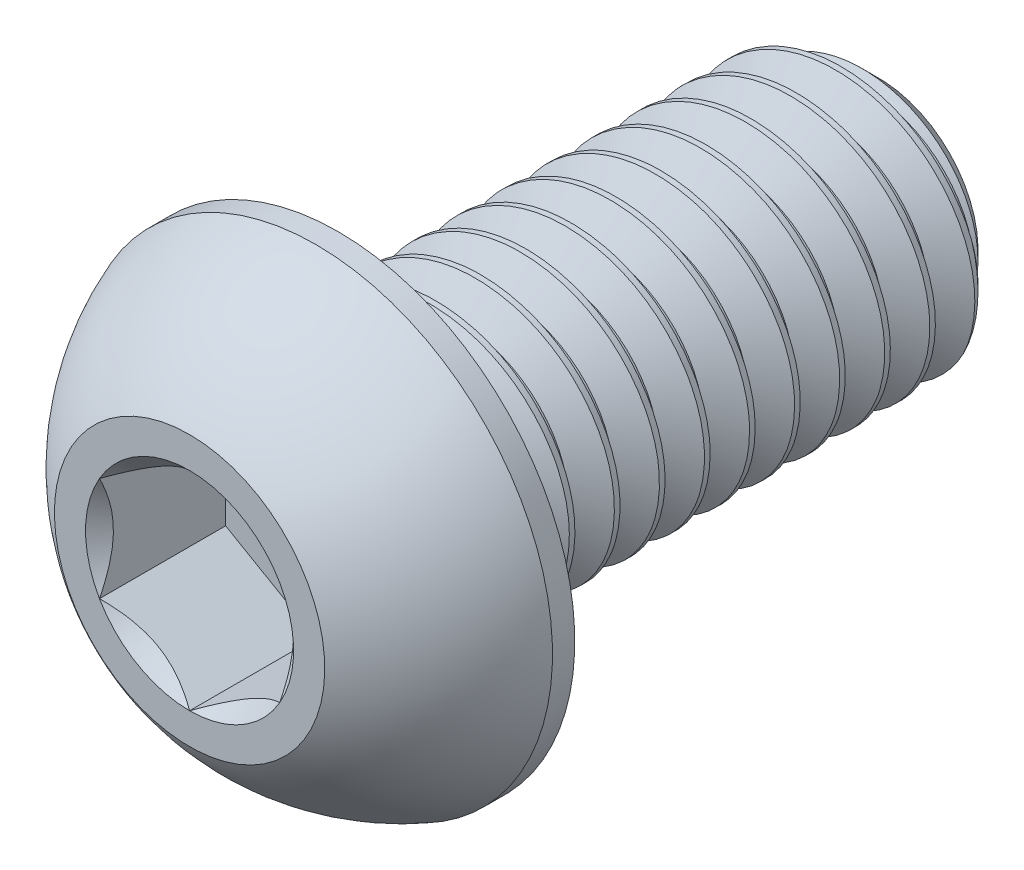
from build123d import *

# Parameters (mm, degrees)
CUT_EXTRUDE1_DEPTH = 2.8
CUT_SWEEP1_PITCH   = 1


# Read off the part's stored shape, not the designer's step: Split1, Boss-Extrude1
with BuildPart() as part:
    # Sketch2 → Revolve1 (revolve)
    with BuildSketch(Plane(origin=(0, 0, 0), x_dir=(0, 0, -1), z_dir=(1, 0, 0)), mode=Mode.PRIVATE) as revolve1_sk:
        with BuildLine():
            Line((-7.65, 0), (7.65, 0))
            Line((7.65, 0), (7.65, 2.2))
            Line((7.65, 2.2), (6.85, 3))
            Line((6.85, 3), (-4.35, 3))
            Line((-4.35, 3), (-4.35, 5.25))
            Line((-4.35, 5.25), (-4.845, 5.25))
            ThreePointArc((-4.845, 5.25), (-6.433520981, 4.356906156), (-7.65, 3))
            Line((-7.65, 3), (-7.65, 0))
        make_face()
    revolve(revolve1_sk.sketch.rotate(Axis((0, 0, 7.65), (0, 0, -1)), 180), axis=Axis((0, 0, 7.65), (0, 0, -1)))

    # Sketch3 → Cut-Extrude1 (cut)
    with BuildSketch(Plane.XY.offset(7.65)):
        Polygon((0, 2.309401077), (-2, 1.154700538), (-2, -1.154700538), (0, -2.309401077), (2, -1.154700538), (2, 1.154700538), align=None)
    extrude(amount=-CUT_EXTRUDE1_DEPTH, mode=Mode.SUBTRACT)

    # Cut-Extrude2 cone 1 section (through the dimple's axis) → Cut-Extrude2 (revolve, cut)
    with BuildSketch(Plane(origin=(0, 0, 7.65), x_dir=(0, -1, 0), z_dir=(1, 0, 0))):
        Polygon((0, 0), (2.309401077, 0), (0, 2.309401077), align=None)
    revolve(axis=Axis((0, 0, 7.65), (0, 0, -1)), mode=Mode.SUBTRACT)


with BuildPart() as body_2:
    # Split1: the piece on the far side of the plane
    add(part.part)
    split(bisect_by=Plane.XY.offset(4.35), keep=Keep.BOTTOM)

    # Cut-Sweep1: the profile of Sketch6 screwed along a right-hand helix of 13 turns, 8 arcs to a turn; built about Z, then put on its axis
    cut_sweep1_z = Axis((0, 0, 0), (0, 0, 1))
    cut_sweep1_corners = [(2.350480947, 0, -0.375), (2.350480947, 0, -0.5), (3.054126588, 0, -0.90625), (3.054126588, 0, 0.03125)]
    with BuildLine(mode=Mode.PRIVATE) as cut_sweep1_profile:
        Line(cut_sweep1_corners[0], cut_sweep1_corners[1])
        Line(cut_sweep1_corners[1], cut_sweep1_corners[2])
        Line(cut_sweep1_corners[2], cut_sweep1_corners[3])
        Line(cut_sweep1_corners[3], cut_sweep1_corners[0])
    cut_sweep1_cap = Face(cut_sweep1_profile.wire())
    cut_sweep1_turn_angles = [0, 22.5, 45, 67.5, 90, 112.5, 135, 157.5, 180, 202.5, 225, 247.5, 270, 292.5, 315, 337.5, 360]
    cut_sweep1_turn_weights = [1, 0.9238795325112867, 1, 0.9238795325112867, 1, 0.9238795325112867, 1, 0.9238795325112867, 1, 0.9238795325112867, 1, 0.9238795325112867, 1, 0.9238795325112867, 1, 0.9238795325112867, 1]
    cut_sweep1_turn_rails = [Edge.make_bspline([Vector(p[0], p[1], 0).rotate(cut_sweep1_z, cut_sweep1_turn_angles[k]) / cut_sweep1_turn_weights[k] + Vector(0, 0, p[2] + CUT_SWEEP1_PITCH * cut_sweep1_turn_angles[k] / 360) for k in range(17)], [0, 0, 0, 1, 1, 2, 2, 3, 3, 4, 4, 5, 5, 6, 6, 7, 7, 8, 8, 8], 2, cut_sweep1_turn_weights) for p in cut_sweep1_corners]
    cut_sweep1_turn_sides = [Face.make_surface_from_curves(cut_sweep1_turn_rails[p[0]], cut_sweep1_turn_rails[p[1]]) for p in [(0, 1), (1, 2), (2, 3), (3, 0)]]
    cut_sweep1 = Plane(origin=(0, 0, -7.65), x_dir=(0, 1, 0), z_dir=(0, 0, 1)) * Solid(Shell([*[p.moved(Location((0, 0, CUT_SWEEP1_PITCH * i))) for i in range(13) for p in cut_sweep1_turn_sides], cut_sweep1_cap, cut_sweep1_cap.rotate(cut_sweep1_z, 4680).moved(Location((0, 0, CUT_SWEEP1_PITCH * 4680 / 360)))]))
    add(cut_sweep1, mode=Mode.SUBTRACT)


with BuildPart() as part_1:
    add(part.part)

    # Split1
    split(bisect_by=Plane.XY.offset(4.35), keep=Keep.TOP)

    add(body_2.part)  # Boss-Extrude1 merges body 2
    # Boss-Extrude1 outline → Boss-Extrude1 (revolve)
    with BuildSketch(Plane.XZ):
        Polygon((2.350478583, 4.35), (2.350478583, 3.224995905), (3, 4.35), align=None)
    revolve(axis=Axis((0, 0, 0), (0, 0, 1)))


solid = part_1.part
